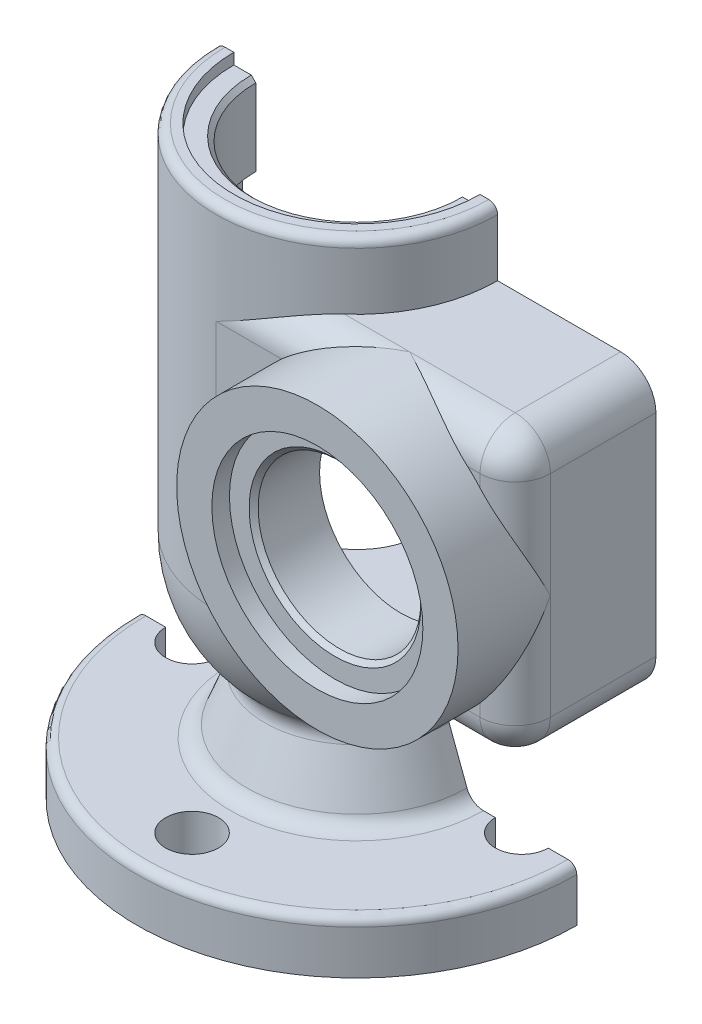
from build123d import *

# Parameters (mm, degrees)
SKETCH2_R           = 30
BOSS_EXTRUDE1_DEPTH = 2
SKETCH3_W           = 64
SKETCH3_H           = 64
BOSS_EXTRUDE2_DEPTH = 68
FILLET1_R           = 8
BOSS_EXTRUDE3_START = -8
SKETCH4_R           = 32
BOSS_EXTRUDE3_DEPTH = 21
FILLET2_R           = 4
SKETCH5_R           = 6
BOSS_EXTRUDE4_DEPTH = 12
SKETCH6_R           = 24
BOSS_EXTRUDE5_DEPTH = 2
SKETCH7_R           = 26
SKETCH8_R           = 23
CUT_EXTRUDE1_DEPTH  = 26
SKETCH13_R          = 26
CUT_EXTRUDE2_DEPTH  = 26
CUT_EXTRUDE3_REACH  = 206.397
SKETCH14_R          = 18
SKETCH15_R          = 24
CUT_EXTRUDE4_DEPTH  = 4
SKETCH20_R          = 28
CUT_EXTRUDE5_DEPTH  = 2.5
FILLET3_R           = 2
SKETCH26_R          = 6
CUT_EXTRUDE6_DEPTH  = 170.49926259


with BuildPart() as part:
    # Sketch1 → Revolve1 (revolve)
    with BuildSketch(Plane.XY, mode=Mode.PRIVATE) as revolve1_sk:
        with BuildLine():
            Line((0, 0), (50, 0))
            Line((50, 0), (50, 12))
            Line((50, 12), (26, 12))
            Line((26, 12), (20, 28))
            ThreePointArc((20, 28), (28.844410204, 39.123585533), (32, 52.979991994))
            Line((32, 52.979991994), (32, 133))
            Line((32, 133), (0, 133))
            Line((0, 133), (0, 0))
        make_face()
    revolve(revolve1_sk.sketch.rotate(Axis((0, 133, 0), (0, -1, 0)), 90), axis=Axis((0, 133, 0), (0, -1, 0)))

    # Sketch2 → Boss-Extrude1 (add)
    with BuildSketch(Plane.XZ):
        with Locations(Location((0, 0, 0), (0, 0, 270))):
            Circle(SKETCH2_R)
    extrude(amount=BOSS_EXTRUDE1_DEPTH)

    # Sketch3 → Boss-Extrude2 (add)
    with BuildSketch(Plane(origin=(0, 0, 0), x_dir=(0, 0, -1), z_dir=(1, 0, 0))):
        with Locations((0, 86)):
            Rectangle(SKETCH3_W, SKETCH3_H)
    extrude(amount=BOSS_EXTRUDE2_DEPTH)

    # Fillet1
    # the kernel refuses this fillet: 8 mm, written as the material it takes off along each edge
    with BuildSketch(Plane(origin=(60, 110, 24), x_dir=(0, 1, 0), z_dir=(0, 0, 1))) as fillet1_piece_1_section:
        Polygon((0, 0), (FILLET1_R * 1.02, 0), (FILLET1_R * 1.02, -FILLET1_R * 1.02), (0, -FILLET1_R * 1.02), align=None)
    fillet1_piece_1 = extrude(amount=FILLET1_R * 1.02, mode=Mode.PRIVATE)
    fillet1_piece_1 = fillet1_piece_1 - Plane(origin=(60, 110, 24), x_dir=(-0.7071067811865475, -0.7071067811865475, 0), z_dir=(0, 0, 1)) * Sphere(FILLET1_R, mode=Mode.PRIVATE)
    add(fillet1_piece_1, mode=Mode.SUBTRACT)
    with BuildSketch(Plane(origin=(60, 62, 24), x_dir=(0, -1, 0), z_dir=(0, 0, 1))) as fillet1_piece_2_section:
        Polygon((0, 0), (FILLET1_R * 1.02, 0), (FILLET1_R * 1.02, FILLET1_R * 1.02), (0, FILLET1_R * 1.02), align=None)
    fillet1_piece_2 = extrude(amount=FILLET1_R * 1.02, mode=Mode.PRIVATE)
    fillet1_piece_2 = fillet1_piece_2 - Plane(origin=(60, 62, 24), x_dir=(-0.7071067811865475, 0.7071067811865475, 0), z_dir=(0, 0, 1)) * Sphere(FILLET1_R, mode=Mode.PRIVATE)
    add(fillet1_piece_2, mode=Mode.SUBTRACT)
    with BuildSketch(Plane(origin=(60, 62, -24), x_dir=(0, -1, 0), z_dir=(0, 0, -1))) as fillet1_piece_3_section:
        Polygon((0, 0), (FILLET1_R * 1.02, 0), (FILLET1_R * 1.02, -FILLET1_R * 1.02), (0, -FILLET1_R * 1.02), align=None)
    fillet1_piece_3 = extrude(amount=FILLET1_R * 1.02, mode=Mode.PRIVATE)
    fillet1_piece_3 = fillet1_piece_3 - Plane(origin=(60, 62, -24), x_dir=(-0.7071067811865475, 0.7071067811865475, 0), z_dir=(0, 0, -1)) * Sphere(FILLET1_R, mode=Mode.PRIVATE)
    add(fillet1_piece_3, mode=Mode.SUBTRACT)
    with BuildSketch(Plane(origin=(60, 110, -24), x_dir=(0, 0, -1), z_dir=(0, 1, 0))) as fillet1_piece_4_section:
        Polygon((0, 0), (FILLET1_R * 1.02, 0), (FILLET1_R * 1.02, -FILLET1_R * 1.02), (0, -FILLET1_R * 1.02), align=None)
    fillet1_piece_4 = extrude(amount=FILLET1_R * 1.02, mode=Mode.PRIVATE)
    fillet1_piece_4 = fillet1_piece_4 - Plane(origin=(60, 110, -24), x_dir=(-0.7071067811865475, 0, 0.7071067811865475), z_dir=(0, 1, 0)) * Sphere(FILLET1_R, mode=Mode.PRIVATE)
    add(fillet1_piece_4, mode=Mode.SUBTRACT)
    with BuildSketch(Plane(origin=(-20, 118, 32), x_dir=(0, -1, 0), z_dir=(1, 0, 0))) as fillet1_piece_5_section:
        with BuildLine():
            CenterArc((FILLET1_R, FILLET1_R), FILLET1_R, 180, 90)
            Line((0, FILLET1_R), (0, 0))
            Line((0, 0), (FILLET1_R, 0))
        make_face()
    fillet1_piece_5 = extrude(amount=80, mode=Mode.PRIVATE)
    fillet1_piece_5 = fillet1_piece_5 - Plane(origin=(0, 116.13109064, 0), x_dir=(0, 0, 1), z_dir=(0, 1, 0)) * Cylinder(32, 192, mode=Mode.PRIVATE)
    add(fillet1_piece_5, mode=Mode.SUBTRACT)
    with BuildSketch(Plane(origin=(-20, 54, 32), x_dir=(0, 1, 0), z_dir=(1, 0, 0))) as fillet1_piece_6_section:
        with BuildLine():
            CenterArc((FILLET1_R, -FILLET1_R), FILLET1_R, 90, 90)
            Line((0, -FILLET1_R), (0, 0))
            Line((0, 0), (FILLET1_R, 0))
        make_face()
    fillet1_piece_6 = extrude(amount=80, mode=Mode.PRIVATE)
    fillet1_piece_6 = fillet1_piece_6 - Plane(origin=(0, 55.86890936, 0), x_dir=(0, 0, 1), z_dir=(0, 1, 0)) * Cylinder(32, 192, mode=Mode.PRIVATE)
    add(fillet1_piece_6, mode=Mode.SUBTRACT)
    with BuildSketch(Plane(origin=(-20, 54, -32), x_dir=(0, 1, 0), z_dir=(1, 0, 0))) as fillet1_piece_7_section:
        with BuildLine():
            CenterArc((FILLET1_R, FILLET1_R), FILLET1_R, 180, 90)
            Line((0, FILLET1_R), (0, 0))
            Line((0, 0), (FILLET1_R, 0))
        make_face()
    fillet1_piece_7 = extrude(amount=80, mode=Mode.PRIVATE)
    fillet1_piece_7 = fillet1_piece_7 - Plane(origin=(0, 55.868908347, 0), x_dir=(0, 0, 1), z_dir=(0, 1, 0)) * Cylinder(32, 193, mode=Mode.PRIVATE)
    add(fillet1_piece_7, mode=Mode.SUBTRACT)
    with BuildSketch(Plane(origin=(-20, 118, -32), x_dir=(0, 0, 1), z_dir=(1, 0, 0))) as fillet1_piece_8_section:
        with BuildLine():
            CenterArc((FILLET1_R, FILLET1_R), FILLET1_R, 180, 90)
            Line((0, FILLET1_R), (0, 0))
            Line((0, 0), (FILLET1_R, 0))
        make_face()
    fillet1_piece_8 = extrude(amount=80, mode=Mode.PRIVATE)
    fillet1_piece_8 = fillet1_piece_8 - Plane(origin=(0, 116.131091799, 0), x_dir=(0, 0, 1), z_dir=(0, 1, 0)) * Cylinder(32, 192, mode=Mode.PRIVATE)
    add(fillet1_piece_8, mode=Mode.SUBTRACT)
    with BuildSketch(Plane(origin=(68, 110, 32), x_dir=(-1, 0, 0), z_dir=(0, -1, 0)), Plane(origin=(68, 54, 24), x_dir=(-1, 0, 0), z_dir=(0, 0, -1)), Plane(origin=(68, 62, -32), x_dir=(-1, 0, 0), z_dir=(0, 1, 0)), Plane(origin=(68, 118, -24), x_dir=(-1, 0, 0), z_dir=(0, 0, 1))) as fillet1_piece_9:
        with BuildLine():
            CenterArc((FILLET1_R, FILLET1_R), FILLET1_R, 180, 90)
            Line((0, FILLET1_R), (0, 0))
            Line((0, 0), (FILLET1_R, 0))
        make_face()
    extrude(amount=48, mode=Mode.SUBTRACT)

    # Sketch4 → Boss-Extrude3 (add)
    with BuildSketch(Plane.XY.offset(32).offset(BOSS_EXTRUDE3_START)):
        with Locations((36, 86)):
            Circle(SKETCH4_R)
    extrude(amount=BOSS_EXTRUDE3_DEPTH)

    # Fillet2
    fillet2_edges = [part.edges().sort_by_distance(p)[0] for p in [
        (0, 28, -20),
        (0, 12, -26),
    ]]
    fillet(fillet2_edges, radius=FILLET2_R)



with BuildPart() as body_2:
    # Sketch5 → Boss-Extrude4 (new body)
    with BuildSketch(Plane.XY.offset(-73)):
        with BuildLine():
            Line((-8.631578947, 69.266137306), (24.210526316, 56.250910766))
            ThreePointArc((24.210526316, 56.250910766), (36, 54), (47.789473684, 56.250910766))
            Line((47.789473684, 56.250910766), (80.631578947, 69.266137306))
            ThreePointArc((80.631578947, 69.266137306), (92, 86), (80.631578947, 102.733862694))
            Line((80.631578947, 102.733862694), (47.789473684, 115.749089234))
            ThreePointArc((47.789473684, 115.749089234), (36, 118), (24.210526316, 115.749089234))
            Line((24.210526316, 115.749089234), (-8.631578947, 102.733862694))
            ThreePointArc((-8.631578947, 102.733862694), (-20, 86), (-8.631578947, 69.266137306))
        make_face()
        with Locations((-2, 86)):
            Circle(SKETCH5_R, mode=Mode.SUBTRACT)
        with Locations((74, 86)):
            Circle(SKETCH5_R, mode=Mode.SUBTRACT)
    extrude(amount=BOSS_EXTRUDE4_DEPTH)

    # Sketch6 → Boss-Extrude5 (add)
    with BuildSketch(Plane(origin=(0, 0, -73), x_dir=(-1, 0, 0), z_dir=(0, 0, -1))):
        with Locations(Location((-36, 86, 0), (0, 0, 180))):
            Circle(SKETCH6_R)
    extrude(amount=BOSS_EXTRUDE5_DEPTH)


with BuildPart() as part_1:
    add(part.part)

    add(body_2.part)  # Loft2 merges body 2
    # Sketch7 → Loft2 section 0
    with BuildSketch(Plane.XY.offset(-61)):
        with Locations((36, 86)):
            Circle(SKETCH7_R)
    # Sketch8 → Loft2 section 1
    with BuildSketch(Plane(origin=(0, 0, -32), x_dir=(-1, 0, 0), z_dir=(0, 0, -1))):
        with Locations((-36, 86)):
            Circle(SKETCH8_R)
    loft()

    # Sketch11 → Cut-Extrude1 (cut, symmetric)
    with BuildSketch(Plane.XY):
        with BuildLine():
            Line((60, 112), (0, 112))
            Line((0, 112), (0, 60))
            Line((0, 60), (60, 60))
            ThreePointArc((60, 60), (61.414213562, 60.585786438), (62, 62))
            Line((62, 62), (62, 110))
            ThreePointArc((62, 110), (61.414213562, 111.414213562), (60, 112))
        make_face()
    extrude(amount=CUT_EXTRUDE1_DEPTH, both=True, mode=Mode.SUBTRACT)

    # Sketch13 → Cut-Extrude2 (cut, symmetric)
    with BuildSketch(Plane(origin=(0, 86, 0), x_dir=(-1, 0, 0), z_dir=(0, -1, 0))):
        Circle(SKETCH13_R)
    extrude(amount=CUT_EXTRUDE2_DEPTH, both=True, mode=Mode.SUBTRACT)

    # Sketch14 → Cut-Extrude3 (cut, up to next)
    with BuildSketch(Plane(origin=(0, 0, -75), x_dir=(-1, 0, 0), z_dir=(0, 0, -1)), mode=Mode.PRIVATE) as cut_extrude3_sk1:
        with Locations((-36, 86)):
            Circle(SKETCH14_R)
    cut_extrude3_tool1 = extrude(cut_extrude3_sk1.sketch, amount=-CUT_EXTRUDE3_REACH, mode=Mode.PRIVATE) & part_1.part
    add(cut_extrude3_tool1.solids().sort_by_distance((36, 86, -75))[0], mode=Mode.SUBTRACT)

    # Sketch15 → Cut-Extrude4 (cut)
    with BuildSketch(Plane.XY.offset(45)):
        with Locations((36, 86)):
            Circle(SKETCH15_R)
    extrude(amount=-CUT_EXTRUDE4_DEPTH, mode=Mode.SUBTRACT)

    # Sketch19 → M39x2.0 Tapped Hole1 (revolve, cut)
    with BuildSketch(Plane(origin=(36, 86, 41), x_dir=(0, -1, 0), z_dir=(1, 0, 0))):
        Polygon((0, 0), (0, 15), (18.5, 15), (18.5, 1.025), (19.525, 0), align=None)
    revolve(axis=Axis((36, 86, 47.35), (0, 0, -1)), mode=Mode.SUBTRACT)

    # Sketch20 → Cut-Extrude5 (cut)
    with BuildSketch(Plane(origin=(0, 133, 0), x_dir=(1, 0, 0), z_dir=(0, 1, 0))):
        with Locations(Location((0, 0, 0), (0, 0, 270))):
            Circle(SKETCH20_R)
    extrude(amount=-CUT_EXTRUDE5_DEPTH, mode=Mode.SUBTRACT)

    # Sketch22 → M48x2.0 Tapped Hole1 (revolve, cut)
    with BuildSketch(Plane(origin=(0, 130.5, 0), x_dir=(0, 0, 1), z_dir=(1, 0, 0))):
        Polygon((0, 0), (0, 18.5), (23, 18.5), (23, 1.025), (24.025, 0), align=None)
    revolve(axis=Axis((0, 136.85, 0), (0, -1, 0)), mode=Mode.SUBTRACT)

    # Sketch23 → Cut-Revolve1 (revolve, cut)
    with BuildSketch(Plane.XY, mode=Mode.PRIVATE) as cut_revolve1_sk:
        Polygon((0, 44), (18, 44), (18, 34), (12.5, 34), (12.5, -2), (0, -2), align=None)
    revolve(cut_revolve1_sk.sketch.rotate(Axis((0, -2, 0), (0, 1, 0)), 90), axis=Axis((0, -2, 0), (0, 1, 0)), mode=Mode.SUBTRACT)

    # Sketch25 → M33x2.0 Tapped Hole1 (revolve, cut)
    with BuildSketch(Plane(origin=(0, 44, 0), x_dir=(0, 0, -1), z_dir=(1, 0, 0))):
        Polygon((0, 0), (0, 16), (15.5, 16), (15.5, 1.025), (16.525, 0), align=None)
    revolve(axis=Axis((0, 37.65, 0), (0, 1, 0)), mode=Mode.SUBTRACT)

    # Fillet3
    fillet3_edges = [part_1.edges().sort_by_distance(p)[0] for p in [
        (64.210526316, 62.758524036, -61),
        (7.789473684, 109.241475964, -61),
        (-20, 86, -61),
        (10, 86, -61),
        (7.789473684, 62.758524036, -61),
        (36, 54, -61),
        (92, 86, -61),
        (64.210526316, 109.241475964, -61),
        (36, 118, -61),
        (30, 112, 26),
        (61.414213562, 111.414213562, 26),
        (62, 86, 26),
        (61.414213562, 60.585786438, 26),
        (30, 60, 26),
        (30, 60, -26),
        (61.414213562, 60.585786438, -26),
        (62, 86, -26),
        (61.414213562, 111.414213562, -26),
        (30, 112, -26),
        (-26, 112, 0),
        (-26, 60, 0),
        (0, 133, -32),
        (0, 12, -50),
    ]]
    fillet(fillet3_edges, radius=FILLET3_R)

    # Sketch26 → Cut-Extrude6 (cut, through all)
    with BuildSketch(Plane(origin=(0, 12, 0), x_dir=(1, 0, 0), z_dir=(0, 1, 0))):
        with Locations(Location((0, 37.5, 0), (0, 0, 270))):
            Circle(SKETCH26_R)
        with Locations(Location((37.5, 0, 0), (0, 0, 270))):
            Circle(SKETCH26_R)
        with Locations(Location((0, -37.5, 0), (0, 0, 270))):
            Circle(SKETCH26_R)
        with Locations(Location((-37.5, 0, 0), (0, 0, 270))):
            Circle(SKETCH26_R)
    extrude(amount=-CUT_EXTRUDE6_DEPTH, mode=Mode.SUBTRACT)

    # Split1
    split(bisect_by=Plane.XY, keep=Keep.TOP)


solid = part_1.part
